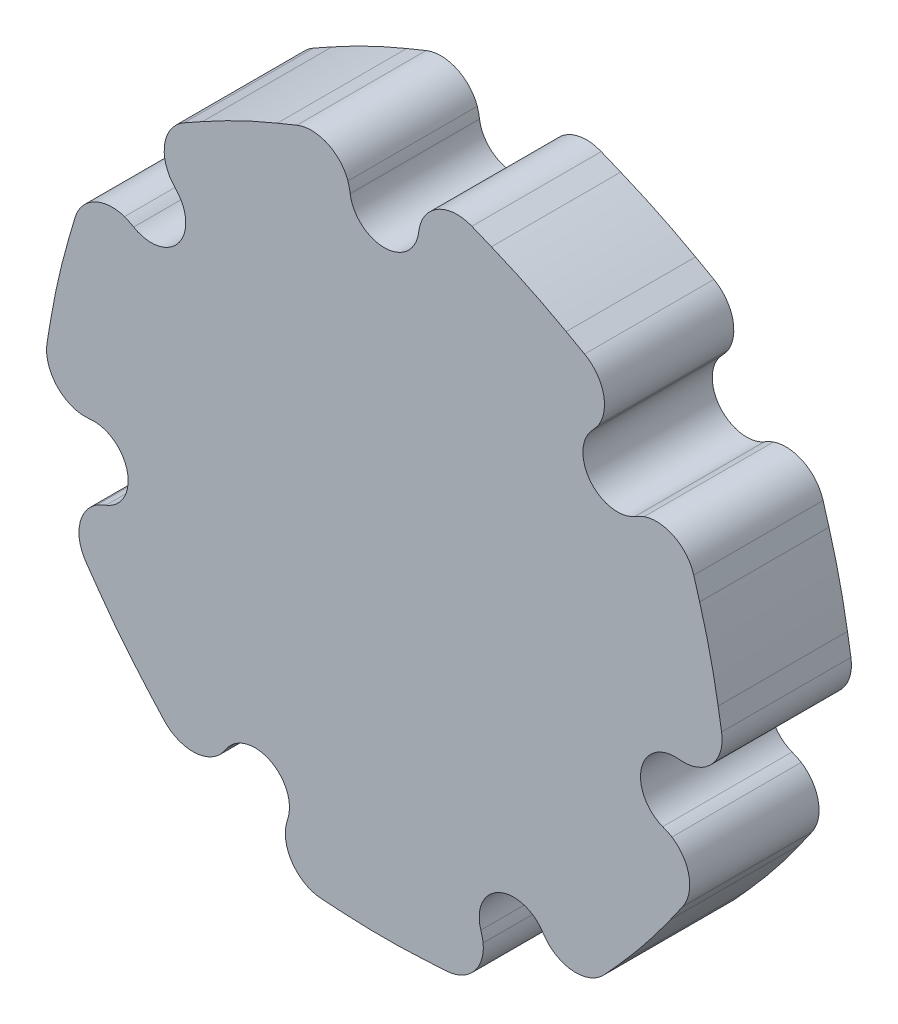
from build123d import *

# Parameters (mm, degrees)
ESTRUSIONE_ESTRUSIONE1_DEPTH = 30
RACCORDO1_R                  = 15
RACCORDO2_R                  = 160


with BuildPart() as part:
    # Schizzo1 → Estrusione-Estrusione1 (new body)
    with BuildSketch(Plane.XY):
        with BuildLine():
            Line((-46.448079544, 63.011055337), (-33.755592428, 70.09420993))
            Line((-33.755592428, 70.09420993), (-20.304122895, 75.601321294))
            ThreePointArc((-20.304122895, 75.601321294), (-13.252536333, 75.502654626), (-8.436946182, 70.35049977))
            Line((-8.436946182, 70.35049977), (-8, 69.15))
            ThreePointArc((-8, 69.15), (0, 61.15), (8, 69.15))
            Line((8, 69.15), (8.436946182, 70.35049977))
            ThreePointArc((8.436946182, 70.35049977), (13.252536333, 75.502654626), (20.304122895, 75.601321294))
            Line((20.304122895, 75.601321294), (33.755592428, 70.09420993))
            Line((33.755592428, 70.09420993), (46.448079544, 63.011055337))
            ThreePointArc((46.448079544, 63.011055337), (50.767531144, 57.4363853), (49.741885624, 50.459089304))
            Line((49.741885624, 50.459089304), (49.075728598, 49.368971658))
            ThreePointArc((49.075728598, 49.368971658), (47.808995153, 38.126401384), (59.051565428, 36.859667939))
            Line((59.051565428, 36.859667939), (60.262585431, 37.266549021))
            ThreePointArc((60.262585431, 37.266549021), (67.293173649, 36.713885045), (71.766906665, 31.262250331))
            Line((71.766906665, 31.262250331), (75.848127696, 17.311840191))
            Line((75.848127696, 17.311840191), (78.223930717, 2.97217952))
            ThreePointArc((78.223930717, 2.97217952), (76.558612201, -3.880653646), (70.464063006, -7.429044586))
            Line((70.464063006, -7.429044586), (69.196432599, -7.587899286))
            ThreePointArc((69.196432599, -7.587899286), (59.61684183, -13.607155111), (65.636097656, -23.186745881))
            Line((65.636097656, -23.186745881), (66.709268717, -23.87987324))
            ThreePointArc((66.709268717, -23.87987324), (70.660678677, -29.721188801), (69.187745938, -36.617932765))
            Line((69.187745938, -36.617932765), (60.82547579, -48.506698308))
            Line((60.82547579, -48.506698308), (51.095566584, -59.304808098))
            ThreePointArc((51.095566584, -59.304808098), (44.699496759, -62.275481245), (38.12536374, -59.722956378))
            Line((38.12536374, -59.722956378), (37.210811503, -58.830927303))
            ThreePointArc((37.210811503, -58.830927303), (26.531990647, -55.094246272), (22.795309617, -65.773067128))
            Line((22.795309617, -65.773067128), (22.922512038, -67.04426389))
            ThreePointArc((22.922512038, -67.04426389), (20.819251446, -73.775601279), (14.508801347, -76.92406562))
            Line((14.508801347, -76.92406562), (0, -77.798703626))
            Line((0, -77.798703626), (-14.508801347, -76.92406562))
            ThreePointArc((-14.508801347, -76.92406562), (-20.819251446, -73.775601279), (-22.922512038, -67.04426389))
            Line((-22.922512038, -67.04426389), (-22.795309617, -65.773067128))
            ThreePointArc((-22.795309617, -65.773067128), (-26.531990647, -55.094246272), (-37.210811503, -58.830927303))
            Line((-37.210811503, -58.830927303), (-38.12536374, -59.722956378))
            ThreePointArc((-38.12536374, -59.722956378), (-44.699496759, -62.275481245), (-51.095566584, -59.304808098))
            Line((-51.095566584, -59.304808098), (-60.82547579, -48.506698308))
            Line((-60.82547579, -48.506698308), (-69.187745938, -36.617932765))
            ThreePointArc((-69.187745938, -36.617932765), (-70.660678677, -29.721188801), (-66.709268717, -23.87987324))
            Line((-66.709268717, -23.87987324), (-65.636097656, -23.186745881))
            ThreePointArc((-65.636097656, -23.186745881), (-59.61684183, -13.607155111), (-69.196432599, -7.587899286))
            Line((-69.196432599, -7.587899286), (-70.464063006, -7.429044586))
            ThreePointArc((-70.464063006, -7.429044586), (-76.558612201, -3.880653646), (-78.223930717, 2.97217952))
            Line((-78.223930717, 2.97217952), (-75.848127696, 17.311840191))
            Line((-75.848127696, 17.311840191), (-71.766906665, 31.262250331))
            ThreePointArc((-71.766906665, 31.262250331), (-67.293173649, 36.713885045), (-60.262585431, 37.266549021))
            Line((-60.262585431, 37.266549021), (-59.051565428, 36.859667939))
            ThreePointArc((-59.051565428, 36.859667939), (-47.808995153, 38.126401384), (-49.075728598, 49.368971658))
            Line((-49.075728598, 49.368971658), (-49.741885624, 50.459089304))
            ThreePointArc((-49.741885624, 50.459089304), (-50.767531144, 57.4363853), (-46.448079544, 63.011055337))
        make_face()
    extrude(amount=ESTRUSIONE_ESTRUSIONE1_DEPTH)

    # Raccordo1
    # the kernel refuses this fillet: 15 mm, written as the material it takes off along each edge
    with BuildSketch(Plane(origin=(8, 69.15, -3.193862928), x_dir=(-0.06981955968385771, -0.9975596368566404, 0), z_dir=(0, 0, 1)), Plane(origin=(-49.075728598, 49.368971658, -3.193862928), x_dir=(0.7363917463007478, -0.6765553901789085, 0), z_dir=(0, 0, 1)), Plane(origin=(-69.196432599, -7.587899286, -3.193862928), x_dir=(0.9880850476667732, 0.15390886451842375, 0), z_dir=(0, 0, 1)), Plane(origin=(-37.210811503, -58.830927303, -3.193862928), x_dir=(0.49573015487791666, 0.8684766050647056, 0), z_dir=(0, 0, 1)), Plane(origin=(22.795309617, -65.773067128, -3.193862928), x_dir=(-0.3699196555863113, 0.9290637483030455, 0), z_dir=(0, 0, 1)), Plane(origin=(65.636097656, -23.186745881, -3.193862928), x_dir=(-0.9570124204082326, 0.2900469396224969, 0), z_dir=(0, 0, 1)), Plane(origin=(59.051565428, 36.859667939, -3.193862928), x_dir=(-0.8234553131670451, -0.5673811304731269, 0), z_dir=(0, 0, 1))) as raccordo1_piece_1:
        with BuildLine():
            CenterArc((2.16440635, 14.963394553), RACCORDO1_R, 256.928571472, 9.067805135)
            Line((-1.228077505, 0.35206151), (-1.295927182, 0.059834849))
            ThreePointArc((-1.295927182, 0.059834849), (-0.696711722, -0.112352983), (-0.082672969, -0.288383738))
            Line((-0.082672969, -0.288383738), (0.020945868, -0.299267891))
            ThreePointArc((0.020945868, -0.299267891), (0.558556477, -0.280477095), (1.096167087, -0.299267891))
            Line((1.096167087, -0.299267891), (1.117112955, 0))
        make_face()
    extrude(amount=36.387725855, mode=Mode.SUBTRACT)
    with BuildSketch(Plane(origin=(-59.051565428, 36.859667939, -3.193862928), x_dir=(-0.9479273461671341, 0.31848665025167716, 0), z_dir=(0, 0, 1)), Plane(origin=(-65.636097656, -23.186745881, -3.193862928), x_dir=(-0.840025923150775, -0.542546263865754, 0), z_dir=(0, 0, 1)), Plane(origin=(-22.795309617, -65.773067128, -3.193862928), x_dir=(-0.09956784659581282, -0.9950307753654017, 0), z_dir=(0, 0, 1)), Plane(origin=(37.210811503, -58.830927303, -3.193862928), x_dir=(0.7158668492597241, -0.698236818086067, 0), z_dir=(0, 0, 1)), Plane(origin=(69.196432599, -7.587899286, -3.193862928), x_dir=(0.9922392066001717, 0.12434370464748737, 0), z_dir=(0, 0, 1)), Plane(origin=(49.075728598, 49.368971658, -3.193862928), x_dir=(0.5214352033794836, 0.8532908816321646, 0), z_dir=(0, 0, 1)), Plane(origin=(-8, 69.15, -3.193862928), x_dir=(-0.3420201433256726, 0.9396926207859071, 0), z_dir=(0, 0, 1))) as raccordo1_piece_2:
        with BuildLine():
            CenterArc((2.042962228, 14.980458495), RACCORDO1_R, 258.007246785, 9.067805135)
            Line((-1.073857364, 0.307850151), (-1.136193756, 0.014397984))
            ThreePointArc((-1.136193756, 0.014397984), (-0.614221596, -0.115691701), (-0.102606043, -0.281907786))
            Line((-0.102606043, -0.281907786), (0, -0.3))
            ThreePointArc((0, -0.3), (0.638772586, -0.3), (1.26223683, -0.29960917))
            Line((1.26223683, -0.29960917), (1.277545171, 0))
        make_face()
    extrude(amount=36.387725855, mode=Mode.SUBTRACT)

    # Raccordo2
    raccordo2_edges = [part.edges().sort_by_distance(p)[0] for p in [
        (-33.755592428, 70.09420993, 15),
        (33.755592428, 70.09420993, 15),
        (75.848127696, 17.311840191, 15),
        (60.82547579, -48.506698308, 15),
        (0, -77.798703626, 15),
        (-60.82547579, -48.506698308, 15),
        (-75.848127696, 17.311840191, 15),
    ]]
    fillet(raccordo2_edges, radius=RACCORDO2_R)


solid = part.part
